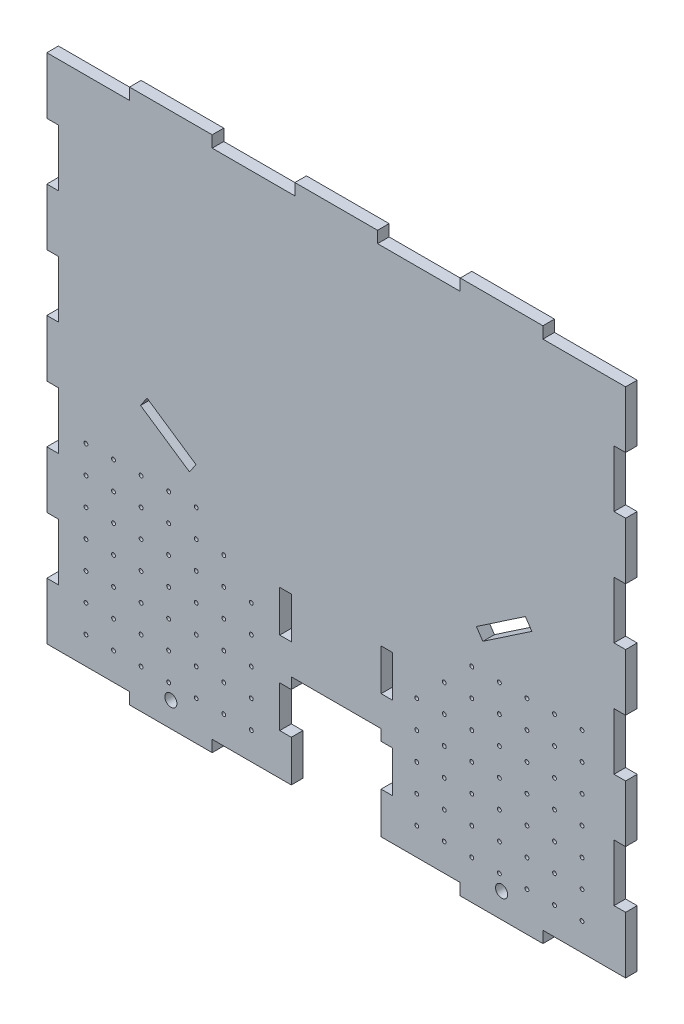
from build123d import *

# Parameters (mm, degrees)
SKETCH1_W           = 266.7
SKETCH1_H           = 246.5832
BOSS_EXTRUDE1_DEPTH = 5.334
SKETCH3_W           = 38.1
SKETCH3_H           = 5.334
CUT_EXTRUDE1_DEPTH  = 326.142186061
SKETCH4_W           = 5.334
SKETCH4_H           = 19.05
CUT_EXTRUDE2_DEPTH  = 326.142186061
SKETCH5_W           = 5.334
SKETCH5_H           = 26.2128
CUT_EXTRUDE3_DEPTH  = 326.142186061
SKETCH6_R           = 0.889
CUT_EXTRUDE4_DEPTH  = 326.142186061
SKETCH7_W           = 41.402
SKETCH7_H           = 48.514
CUT_EXTRUDE5_DEPTH  = 326.142186061
SKETCH8_R           = 2.794
CUT_EXTRUDE6_DEPTH  = 326.142186061


with BuildPart() as part:
    # Sketch1 → Boss-Extrude1 (new body)
    with BuildSketch(Plane.XY):
        with Locations((-107.591743392, 94.965280514)):
            Rectangle(SKETCH1_W, SKETCH1_H)
    extrude(amount=BOSS_EXTRUDE1_DEPTH)

    # Sketch3 → Cut-Extrude1 (cut, through all)
    with BuildSketch(Plane.XY.offset(5.334)):
        with Locations((-221.891743392, 215.589880514)):
            Rectangle(SKETCH3_W, SKETCH3_H)
        with Locations((-145.691743392, 215.589880514)):
            Rectangle(SKETCH3_W, SKETCH3_H)
        with Locations((-69.491743392, 215.589880514)):
            Rectangle(SKETCH3_W, SKETCH3_H)
        with Locations((6.708256608, 215.589880514)):
            Rectangle(SKETCH3_W, SKETCH3_H)
        with Locations((6.708256608, -25.659319486)):
            Rectangle(SKETCH3_W, SKETCH3_H)
        with Locations((-69.491743392, -25.659319486)):
            Rectangle(SKETCH3_W, SKETCH3_H)
        with Locations((-145.691743392, -25.659319486)):
            Rectangle(SKETCH3_W, SKETCH3_H)
        with Locations((-221.891743392, -25.659319486)):
            Rectangle(SKETCH3_W, SKETCH3_H)
    extrude(amount=-CUT_EXTRUDE1_DEPTH, mode=Mode.SUBTRACT)

    # Sketch4 → Cut-Extrude2 (cut, through all)
    with BuildSketch(Plane.XY.offset(5.334)):
        with Locations((-130.959743392, 43.682680514)):
            Rectangle(SKETCH4_W, SKETCH4_H)
        with Locations((-130.959743392, 5.582680514)):
            Rectangle(SKETCH4_W, SKETCH4_H)
        Polygon((-172.200485432, 82.908520677), (-175.189075092, 78.490388963), (-197.753829731, 93.754033589), (-194.765240071, 98.172165303), align=None)
        Polygon((-20.418246712, 98.172165303), (-17.429657052, 93.754033589), (-39.994411692, 78.490388963), (-42.983001352, 82.908520677), align=None)
        with Locations((-84.223743392, 5.582680514)):
            Rectangle(SKETCH4_W, SKETCH4_H)
        with Locations((-84.223743392, 43.682680514)):
            Rectangle(SKETCH4_W, SKETCH4_H)
    extrude(amount=-CUT_EXTRUDE2_DEPTH, mode=Mode.SUBTRACT)

    # Sketch5 → Cut-Extrude3 (cut, through all)
    with BuildSketch(Plane.XY.offset(5.334)):
        with Locations((-238.274743392, 173.603680514)):
            Rectangle(SKETCH5_W, SKETCH5_H)
        with Locations((-238.274743392, 121.178080514)):
            Rectangle(SKETCH5_W, SKETCH5_H)
        with Locations((-238.274743392, 68.752480514)):
            Rectangle(SKETCH5_W, SKETCH5_H)
        with Locations((-238.274743392, 16.326880514)):
            Rectangle(SKETCH5_W, SKETCH5_H)
        with Locations((23.091256608, 16.326880514)):
            Rectangle(SKETCH5_W, SKETCH5_H)
        with Locations((23.091256608, 68.752480514)):
            Rectangle(SKETCH5_W, SKETCH5_H)
        with Locations((23.091256608, 121.178080514)):
            Rectangle(SKETCH5_W, SKETCH5_H)
        with Locations((23.091256608, 173.603680514)):
            Rectangle(SKETCH5_W, SKETCH5_H)
    extrude(amount=-CUT_EXTRUDE3_DEPTH, mode=Mode.SUBTRACT)

    # Sketch6 → Cut-Extrude4 (cut, through all)
    with BuildSketch(Plane.XY.offset(5.334)):
        with Locations((-222.907743392, -10.292319486)):
            Circle(SKETCH6_R)
        with Locations((-210.207743392, -10.292319486)):
            Circle(SKETCH6_R)
        with Locations((-197.507743392, -10.292319486)):
            Circle(SKETCH6_R)
        with Locations((-184.807743392, -10.292319486)):
            Circle(SKETCH6_R)
        with Locations((-172.107743392, -10.292319486)):
            Circle(SKETCH6_R)
        with Locations((-159.407743392, -10.292319486)):
            Circle(SKETCH6_R)
        with Locations((-146.707743392, -10.292319486)):
            Circle(SKETCH6_R)
        with Locations((-70.507743392, -10.292319486)):
            Circle(SKETCH6_R)
        with Locations((-57.807743392, -10.292319486)):
            Circle(SKETCH6_R)
        with Locations((-45.107743392, -10.292319486)):
            Circle(SKETCH6_R)
        with Locations((-32.407743392, -10.292319486)):
            Circle(SKETCH6_R)
        with Locations((-19.707743392, -10.292319486)):
            Circle(SKETCH6_R)
        with Locations((-7.007743392, -10.292319486)):
            Circle(SKETCH6_R)
        with Locations((5.692256608, -10.292319486)):
            Circle(SKETCH6_R)
        with Locations((-210.207743392, 2.407680514)):
            Circle(SKETCH6_R)
        with Locations((-197.507743392, 2.407680514)):
            Circle(SKETCH6_R)
        with Locations((-184.807743392, 2.407680514)):
            Circle(SKETCH6_R)
        with Locations((-172.107743392, 2.407680514)):
            Circle(SKETCH6_R)
        with Locations((-159.407743392, 2.407680514)):
            Circle(SKETCH6_R)
        with Locations((-146.707743392, 2.407680514)):
            Circle(SKETCH6_R)
        with Locations((-70.507743392, 2.407680514)):
            Circle(SKETCH6_R)
        with Locations((-57.807743392, 2.407680514)):
            Circle(SKETCH6_R)
        with Locations((-45.107743392, 2.407680514)):
            Circle(SKETCH6_R)
        with Locations((-32.407743392, 2.407680514)):
            Circle(SKETCH6_R)
        with Locations((-19.707743392, 2.407680514)):
            Circle(SKETCH6_R)
        with Locations((-7.007743392, 2.407680514)):
            Circle(SKETCH6_R)
        with Locations((5.692256608, 2.407680514)):
            Circle(SKETCH6_R)
        with Locations((-210.207743392, 15.107680514)):
            Circle(SKETCH6_R)
        with Locations((-197.507743392, 15.107680514)):
            Circle(SKETCH6_R)
        with Locations((-184.807743392, 15.107680514)):
            Circle(SKETCH6_R)
        with Locations((-172.107743392, 15.107680514)):
            Circle(SKETCH6_R)
        with Locations((-159.407743392, 15.107680514)):
            Circle(SKETCH6_R)
        with Locations((-146.707743392, 15.107680514)):
            Circle(SKETCH6_R)
        with Locations((-70.507743392, 15.107680514)):
            Circle(SKETCH6_R)
        with Locations((-57.807743392, 15.107680514)):
            Circle(SKETCH6_R)
        with Locations((-45.107743392, 15.107680514)):
            Circle(SKETCH6_R)
        with Locations((-32.407743392, 15.107680514)):
            Circle(SKETCH6_R)
        with Locations((-19.707743392, 15.107680514)):
            Circle(SKETCH6_R)
        with Locations((-7.007743392, 15.107680514)):
            Circle(SKETCH6_R)
        with Locations((5.692256608, 15.107680514)):
            Circle(SKETCH6_R)
        with Locations((-210.207743392, 27.807680514)):
            Circle(SKETCH6_R)
        with Locations((-197.507743392, 27.807680514)):
            Circle(SKETCH6_R)
        with Locations((-184.807743392, 27.807680514)):
            Circle(SKETCH6_R)
        with Locations((-172.107743392, 27.807680514)):
            Circle(SKETCH6_R)
        with Locations((-159.407743392, 27.807680514)):
            Circle(SKETCH6_R)
        with Locations((-146.707743392, 27.807680514)):
            Circle(SKETCH6_R)
        with Locations((-70.507743392, 27.807680514)):
            Circle(SKETCH6_R)
        with Locations((-57.807743392, 27.807680514)):
            Circle(SKETCH6_R)
        with Locations((-45.107743392, 27.807680514)):
            Circle(SKETCH6_R)
        with Locations((-32.407743392, 27.807680514)):
            Circle(SKETCH6_R)
        with Locations((-19.707743392, 27.807680514)):
            Circle(SKETCH6_R)
        with Locations((-7.007743392, 27.807680514)):
            Circle(SKETCH6_R)
        with Locations((5.692256608, 27.807680514)):
            Circle(SKETCH6_R)
        with Locations((-210.207743392, 40.507680514)):
            Circle(SKETCH6_R)
        with Locations((-197.507743392, 40.507680514)):
            Circle(SKETCH6_R)
        with Locations((-184.807743392, 40.507680514)):
            Circle(SKETCH6_R)
        with Locations((-172.107743392, 40.507680514)):
            Circle(SKETCH6_R)
        with Locations((-159.407743392, 40.507680514)):
            Circle(SKETCH6_R)
        with Locations((-146.707743392, 40.507680514)):
            Circle(SKETCH6_R)
        with Locations((-70.507743392, 40.507680514)):
            Circle(SKETCH6_R)
        with Locations((-57.807743392, 40.507680514)):
            Circle(SKETCH6_R)
        with Locations((-45.107743392, 40.507680514)):
            Circle(SKETCH6_R)
        with Locations((-32.407743392, 40.507680514)):
            Circle(SKETCH6_R)
        with Locations((-19.707743392, 40.507680514)):
            Circle(SKETCH6_R)
        with Locations((-7.007743392, 40.507680514)):
            Circle(SKETCH6_R)
        with Locations((5.692256608, 40.507680514)):
            Circle(SKETCH6_R)
        with Locations((-210.207743392, 53.207680514)):
            Circle(SKETCH6_R)
        with Locations((-197.507743392, 53.207680514)):
            Circle(SKETCH6_R)
        with Locations((-184.807743392, 53.207680514)):
            Circle(SKETCH6_R)
        with Locations((-172.107743392, 53.207680514)):
            Circle(SKETCH6_R)
        with Locations((-159.407743392, 53.207680514)):
            Circle(SKETCH6_R)
        with Locations((-57.807743392, 53.207680514)):
            Circle(SKETCH6_R)
        with Locations((-45.107743392, 53.207680514)):
            Circle(SKETCH6_R)
        with Locations((-32.407743392, 53.207680514)):
            Circle(SKETCH6_R)
        with Locations((-19.707743392, 53.207680514)):
            Circle(SKETCH6_R)
        with Locations((-7.007743392, 53.207680514)):
            Circle(SKETCH6_R)
        with Locations((5.692256608, 53.207680514)):
            Circle(SKETCH6_R)
        with Locations((-210.207743392, 65.907680514)):
            Circle(SKETCH6_R)
        with Locations((-197.507743392, 65.907680514)):
            Circle(SKETCH6_R)
        with Locations((-184.807743392, 65.907680514)):
            Circle(SKETCH6_R)
        with Locations((-172.107743392, 65.907680514)):
            Circle(SKETCH6_R)
        with Locations((-45.107743392, 65.907680514)):
            Circle(SKETCH6_R)
        with Locations((-32.407743392, 65.907680514)):
            Circle(SKETCH6_R)
        with Locations((-19.707743392, 65.907680514)):
            Circle(SKETCH6_R)
        with Locations((-7.007743392, 65.907680514)):
            Circle(SKETCH6_R)
        with Locations((5.692256608, 65.907680514)):
            Circle(SKETCH6_R)
        with Locations((-222.907743392, 2.407680514)):
            Circle(SKETCH6_R)
        with Locations((-222.907743392, 15.107680514)):
            Circle(SKETCH6_R)
        with Locations((-222.907743392, 27.807680514)):
            Circle(SKETCH6_R)
        with Locations((-222.907743392, 40.507680514)):
            Circle(SKETCH6_R)
        with Locations((-222.907743392, 53.207680514)):
            Circle(SKETCH6_R)
        with Locations((-222.907743392, 65.907680514)):
            Circle(SKETCH6_R)
    extrude(amount=-CUT_EXTRUDE4_DEPTH, mode=Mode.SUBTRACT)

    # Sketch7 → Cut-Extrude5 (cut, through all)
    with BuildSketch(Plane.XY.offset(5.334)):
        with Locations((-107.591743392, -4.069319486)):
            Rectangle(SKETCH7_W, SKETCH7_H)
    extrude(amount=-CUT_EXTRUDE5_DEPTH, mode=Mode.SUBTRACT)

    # Sketch8 → Cut-Extrude6 (cut, through all)
    with BuildSketch(Plane.XY.offset(5.334)):
        with Locations((-183.791743392, -16.896319486)):
            Circle(SKETCH8_R)
        with Locations((-31.391743392, -16.896319486)):
            Circle(SKETCH8_R)
    extrude(amount=-CUT_EXTRUDE6_DEPTH, mode=Mode.SUBTRACT)


solid = part.part
